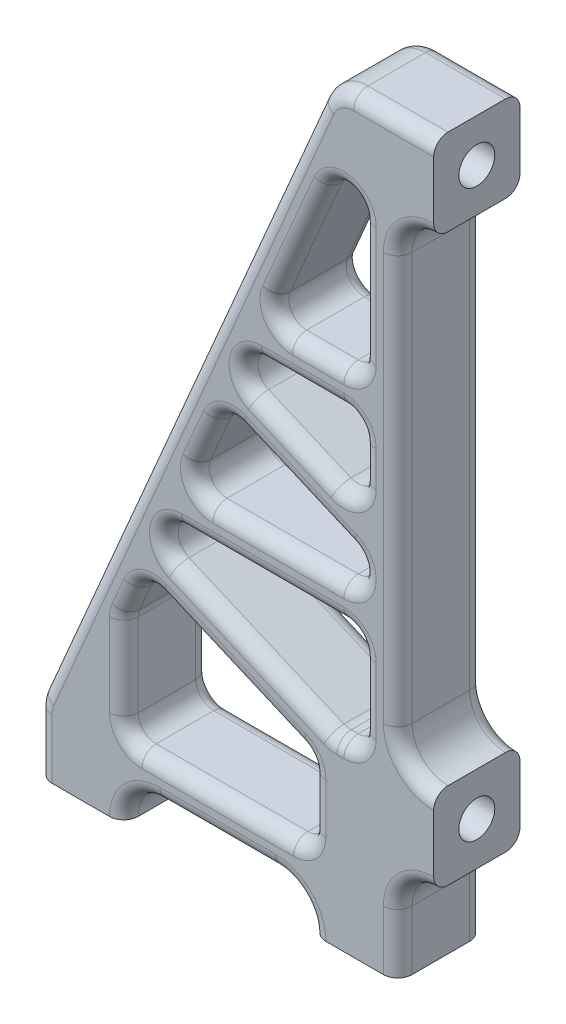
from build123d import *

# Parameters (mm, degrees)
EXTRUDE_1_DEPTH     = 6
EXTRUDE_2_DEPTH     = 6
FILLET_1_R          = 1.25
SKETCH_3_R          = 1.25
CUT_EXTRUDE_1_DEPTH = 6
SKETCH_4_R          = 1.25
CUT_EXTRUDE_2_DEPTH = 6
FILLET_7_R          = 1


with BuildPart() as part:
    # Эскиз1 → Бобышка-Вытянуть1 (new body)
    with BuildSketch(Plane.XY):
        with BuildLine():
            Line((27.55, 46), (27.55, 52))
            Line((27.55, 52), (21.979013428, 52))
            ThreePointArc((21.979013428, 52), (20.603460613, 51.587547473), (19.681787986, 50.486283563))
            Line((19.681787986, 50.486283563), (0.202774557, 5.116283563))
            ThreePointArc((0.202774557, 5.116283563), (0.051218302, 4.633456251), (0, 4.13))
            Line((0, 4.13), (0, 0))
            Line((0, 0), (6, 0))
            ThreePointArc((6, 0), (6.732233047, 1.767766953), (8.5, 2.5))
            Line((8.5, 2.5), (16.55, 2.5))
            ThreePointArc((16.55, 2.5), (18.317766953, 1.767766953), (19.05, 0))
            Line((19.05, 0), (25.05, 0))
            Line((25.05, 0), (25.05, 4.13))
            ThreePointArc((25.05, 4.13), (25.782233047, 5.897766953), (27.55, 6.63))
            Line((27.55, 6.63), (27.55, 12.63))
            ThreePointArc((27.55, 12.63), (25.782233047, 13.362233047), (25.05, 15.13))
            Line((25.05, 15.13), (25.05, 43.5))
            ThreePointArc((25.05, 43.5), (25.782233047, 45.267766953), (27.55, 46))
        make_face()
        with BuildLine():
            Line((19.05, 6.25), (19.05, 11.38))
            ThreePointArc((19.05, 11.38), (19.416116524, 12.263883476), (20.3, 12.63))
            Line((20.3, 12.63), (21.3, 12.63))
            ThreePointArc((21.3, 12.63), (22.183883476, 12.996116524), (22.55, 13.88))
            Line((22.55, 13.88), (22.55, 44.75))
            ThreePointArc((22.55, 44.75), (21.551728126, 45.974390849), (20.151387279, 45.243141781))
            Line((20.151387279, 45.243141781), (6.101387279, 12.518255465))
            ThreePointArc((6.101387279, 12.518255465), (6.025609151, 12.276841809), (6, 12.025113683))
            Line((6, 12.025113683), (6, 6.25))
            ThreePointArc((6, 6.25), (6.366116524, 5.366116524), (7.25, 5))
            Line((7.25, 5), (17.8, 5))
            ThreePointArc((17.8, 5), (18.683883476, 5.366116524), (19.05, 6.25))
        make_face(mode=Mode.SUBTRACT)
    extrude(amount=EXTRUDE_1_DEPTH)

    # Эскиз2 → Бобышка-Вытянуть2 (add)
    with BuildSketch(Plane.XY):
        with BuildLine():
            Line((8.884920779, 19.00158766), (7.405495422, 15.555749466))
            Line((7.405495422, 15.555749466), (19.05, 10.556334411))
            Line((19.05, 10.556334411), (19.05, 11.38))
            ThreePointArc((19.05, 11.38), (19.416116524, 12.263883476), (20.3, 12.63))
            Line((20.3, 12.63), (20.556993228, 12.63))
            Line((20.556993228, 12.63), (9.540391706, 17.359833127))
            ThreePointArc((9.540391706, 17.359833127), (8.872637739, 18.044957917), (8.884920779, 19.00158766))
        make_face()
        with BuildLine():
            Line((15.821872075, 35.15895012), (14.4235828, 31.902091931))
            ThreePointArc((14.4235828, 31.902091931), (14.884419115, 32.452723865), (15.572195509, 32.65895012))
            Line((15.572195509, 32.65895012), (22.55, 32.65895012))
            Line((22.55, 32.65895012), (22.55, 35.15895012))
            Line((22.55, 35.15895012), (15.821872075, 35.15895012))
        make_face()
        with BuildLine():
            ThreePointArc((21.793141781, 24.65705857), (22.343773752, 24.196222233), (22.55, 23.508445793))
            Line((22.55, 23.508445793), (22.55, 27.05278477))
            Line((22.55, 27.05278477), (15.079053727, 30.260337399))
            ThreePointArc((15.079053727, 30.260337399), (14.411299761, 30.945462188), (14.4235828, 31.902091931))
            Line((14.4235828, 31.902091931), (12.944157443, 28.456253737))
            Line((12.944157443, 28.456253737), (21.793141781, 24.65705857))
        make_face()
        with BuildLine():
            Line((10.283210053, 22.258445849), (8.884920779, 19.00158766))
            ThreePointArc((8.884920779, 19.00158766), (9.345757093, 19.552219594), (10.033533487, 19.758445849))
            Line((10.033533487, 19.758445849), (22.55, 19.758445849))
            Line((22.55, 19.758445849), (22.55, 23.508445793))
            ThreePointArc((22.55, 23.508445793), (22.183883457, 22.624562353), (21.3, 22.258445849))
            Line((21.3, 22.258445849), (10.283210053, 22.258445849))
        make_face()
    extrude(amount=EXTRUDE_2_DEPTH)

    # Скругление1
    fillet_1_edges = [part.edges().sort_by_distance(p)[0] for p in [
        (19.05, 10.556334411, 3),
        (20.556993228, 12.63, 3),
        (7.405495422, 15.555749466, 3),
        (22.55, 19.758445849, 3),
        (10.283210053, 22.258445849, 3),
        (12.944157443, 28.456253737, 3),
        (22.55, 27.05278477, 3),
        (22.55, 32.65895012, 3),
        (15.821872075, 35.15895012, 3),
        (22.55, 35.15895012, 3),
    ]]
    fillet(fillet_1_edges, radius=FILLET_1_R)

    # Эскиз3 → Вырез-Вытянуть1 (cut)
    with BuildSketch(Plane(origin=(27.55, 0, 0), x_dir=(0, 0, -1), z_dir=(1, 0, 0))):
        with Locations((-3, 49)):
            Circle(SKETCH_3_R)
        with Locations((-3, 9.63)):
            Circle(SKETCH_3_R)
    extrude(amount=-CUT_EXTRUDE_1_DEPTH, mode=Mode.SUBTRACT)

    # Эскиз4 → Вырез-Вытянуть2 (cut)
    with BuildSketch(Plane.XZ):
        with Locations((3, 3)):
            Circle(SKETCH_4_R)
        with Locations((22.05, 3)):
            Circle(SKETCH_4_R)
    extrude(amount=-CUT_EXTRUDE_2_DEPTH, mode=Mode.SUBTRACT)

    # Скругление7
    fillet_7_edges = [part.edges().sort_by_distance(p)[0] for p in [
        (21.551728126, 45.974390849, 6),
        (14.34780466, 31.660678245, 6),
        (18.436097754, 32.65895012, 6),
        (17.942955973, 26.310085263, 6),
        (22.524390849, 23.256717723, 6),
        (14.93061819, 15.045610203, 6),
        (8.809142638, 18.760173974, 6),
        (15.666766744, 19.758445849, 6),
        (25.782233047, 13.362233047, 6),
        (25.782233047, 45.267766953, 6),
        (25.782233047, 5.897766953, 6),
        (6.732233047, 1.767766953, 6),
        (18.317766953, 1.767766953, 6),
        (24.764506714, 52, 6),
        (20.603460613, 51.587547473, 6),
        (0, 2.065, 6),
        (0.051218302, 4.633456251, 6),
        (19.509439909, 35.15895012, 6),
        (17.942955973, 29.030758595, 6),
        (16.740108899, 22.258445849, 6),
        (25.05, 29.315, 6),
        (25.05, 2.065, 6),
        (12.525, 2.5, 6),
        (9.942281272, 27.801283563, 6),
        (16.675106082, 35.721173712, 6),
        (18.360827188, 41.072616841, 6),
        (22.55, 40.57947506, 6),
        (22.183883476, 35.525066643, 6),
        (22.183883476, 32.292833596, 6),
        (22.55, 30.179371317, 6),
        (21.987776407, 27.906018777, 6),
        (11.13644406, 22.820669441, 6),
        (11.741310369, 25.654614323, 6),
        (13.136140437, 27.975394977, 6),
        (16.675106082, 35.721173712, 0),
        (18.360827188, 41.072616841, 0),
        (21.551728126, 45.974390849, 0),
        (22.55, 40.57947506, 0),
        (22.183883476, 35.525066643, 0),
        (14.34780466, 31.660678245, 0),
        (18.436097754, 32.65895012, 0),
        (22.183883476, 32.292833596, 0),
        (22.55, 30.179371317, 0),
        (21.987776407, 27.906018777, 0),
        (11.13644406, 22.820669441, 0),
        (11.741310369, 25.654614323, 0),
        (13.136140437, 27.975394977, 0),
        (17.942955973, 26.310085263, 0),
        (22.524390849, 23.256717723, 0),
        (20.562258331, 12.655609151, 0),
        (21.056993228, 12.63, 0),
        (22.183883476, 12.996116524, 0),
        (22.55, 16.194222924, 0),
        (22.183883476, 19.392329325, 0),
        (15.666766744, 19.758445849, 0),
        (8.809142638, 18.760173974, 0),
        (6.366116524, 5.366116524, 0),
        (6, 9.137556842, 0),
        (6.025609151, 12.276841809, 0),
        (6.50687046, 13.462696105, 0),
        (7.597478415, 15.074890706, 0),
        (13.423624962, 12.971944614, 0),
        (18.843773737, 10.42044523, 0),
        (19.05, 7.991334411, 0),
        (18.683883476, 5.366116524, 0),
        (24.764506714, 52, 0),
        (20.603460613, 51.587547473, 0),
        (0, 2.065, 0),
        (0.051218302, 4.633456251, 0),
        (6.732233047, 1.767766953, 0),
        (18.317766953, 1.767766953, 0),
        (25.782233047, 5.897766953, 0),
        (25.782233047, 13.362233047, 0),
        (25.782233047, 45.267766953, 0),
        (20.562258331, 12.655609151, 6),
        (21.056993228, 12.63, 6),
        (22.183883476, 12.996116524, 6),
        (22.55, 16.194222924, 6),
        (22.183883476, 19.392329325, 6),
        (18.683883476, 5.366116524, 6),
        (12.525, 5, 6),
        (6.366116524, 5.366116524, 6),
        (6, 9.137556842, 6),
        (6.025609151, 12.276841809, 6),
        (6.50687046, 13.462696105, 6),
        (7.597478415, 15.074890706, 6),
        (13.423624962, 12.971944614, 6),
        (18.843773737, 10.42044523, 6),
        (19.509439909, 35.15895012, 0),
        (17.942955973, 29.030758595, 0),
        (16.740108899, 22.258445849, 0),
        (14.93061819, 15.045610203, 0),
        (12.525, 5, 0),
        (9.942281272, 27.801283563, 0),
        (12.525, 2.5, 0),
        (25.05, 2.065, 0),
        (25.05, 29.315, 0),
        (19.05, 7.991334411, 6),
    ]]
    fillet(fillet_7_edges, radius=FILLET_7_R)


solid = part.part
